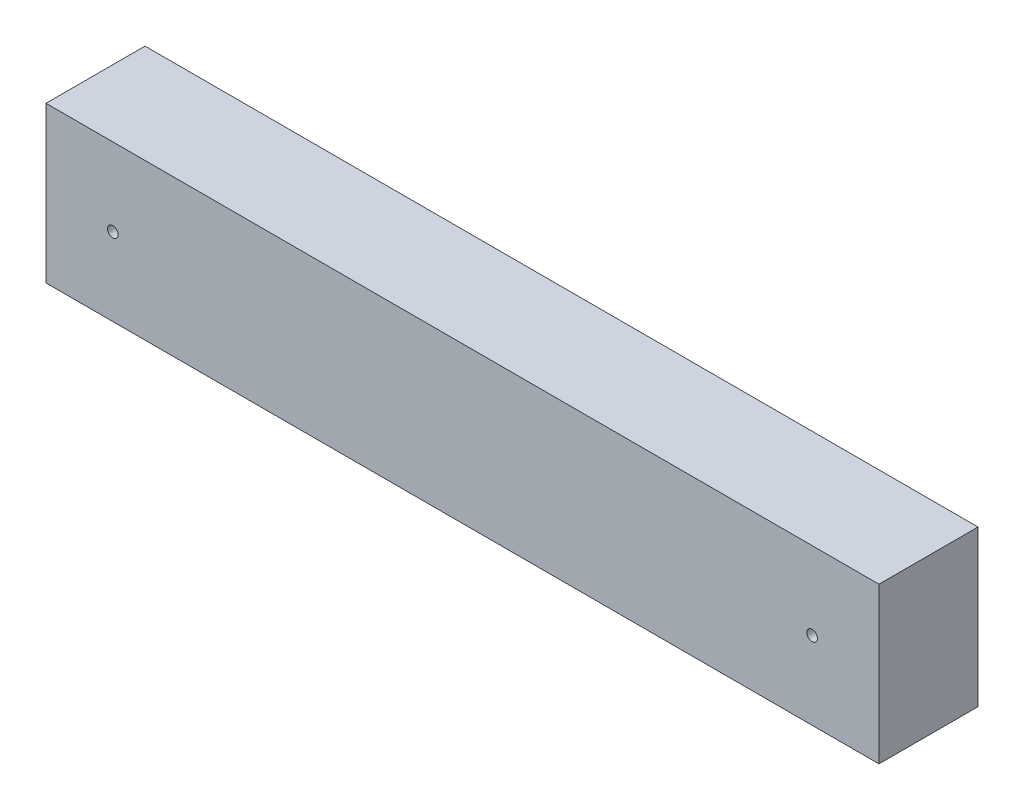
from build123d import *

# Parameters (mm, degrees)
SKETCH1_W           = 747.7252
SKETCH1_H           = 139.7
BOSS_EXTRUDE1_DEPTH = 88.9
SKETCH2_R           = 4.7625
CUT_EXTRUDE1_DEPTH  = 391.583507305


with BuildPart() as part:
    # Sketch1 → Boss-Extrude1 (new body)
    with BuildSketch(Plane.XY):
        Rectangle(SKETCH1_W, SKETCH1_H)
    extrude(amount=BOSS_EXTRUDE1_DEPTH)

    # Sketch2 → Cut-Extrude1 (cut, through all)
    with BuildSketch(Plane.XY.offset(88.9)):
        with Locations((-313.8626, 0)):
            Circle(SKETCH2_R)
        with Locations((313.8626, 0)):
            Circle(SKETCH2_R)
    extrude(amount=-CUT_EXTRUDE1_DEPTH, mode=Mode.SUBTRACT)


solid = part.part
